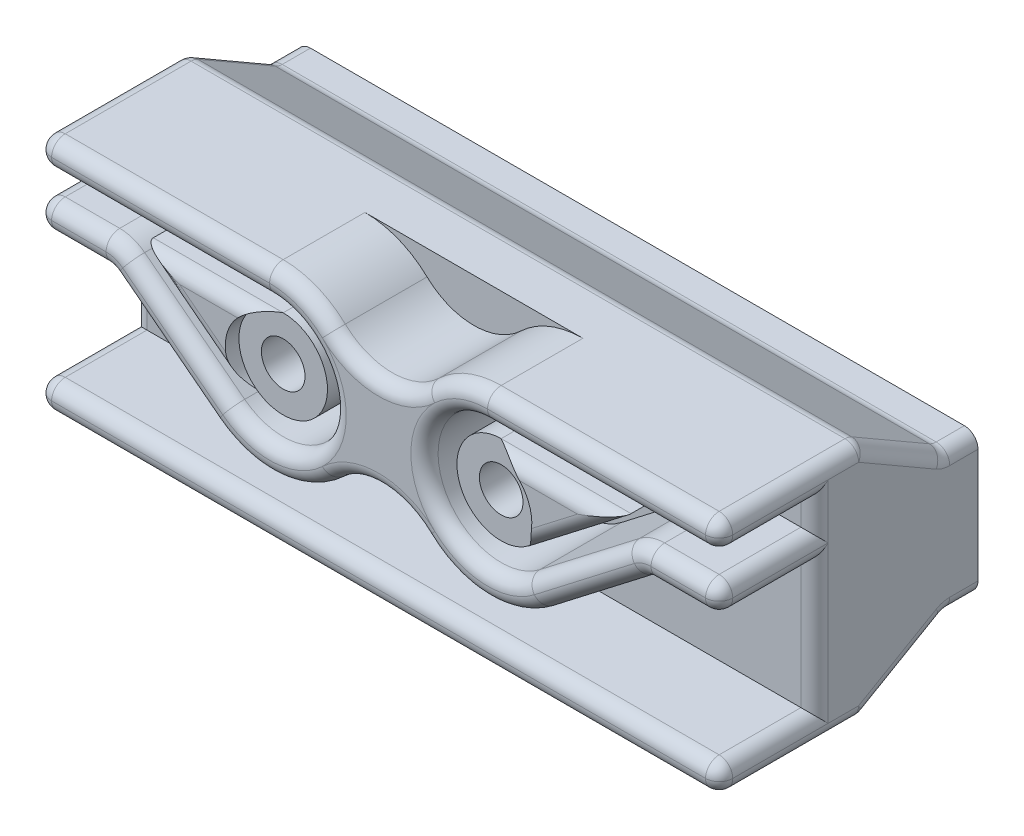
from build123d import *

# Parameters (mm, degrees)
SKETCH_1_W          = 50
SKETCH_1_H          = 17.48
EXTRUDE_1_DEPTH     = 12
EXTRUDE_START       = 12
SKETCH_1_3_W        = 50
SKETCH_1_3_H        = 2
EXTRUDE_2_DEPTH     = 7
SKETCH_1_4_R        = 1.6
CUT_EXTRUDE_1_DEPTH = 19
CUT_EXTRUDE_3_DEPTH = 25
FILLET_1_R          = 1
CUT_EXTRUDE_START   = -1
SKETCH_2_R          = 3.25
CUT_EXTRUDE_2_DEPTH = 1


with BuildPart() as part:
    # Эскиз1 → Бобышка-Вытянуть1 (new body)
    with BuildSketch(Plane.XY):
        Rectangle(SKETCH_1_W, SKETCH_1_H)
    extrude(amount=EXTRUDE_1_DEPTH)

    # Эскиз1<3> → Бобышка-Вытянуть2 (add)
    with BuildSketch(Plane.XY.offset(EXTRUDE_START)):
        with Locations((0, -7.74)):
            Rectangle(SKETCH_1_3_W, SKETCH_1_3_H)
        with BuildLine():
            Line((20, 2.73), (25, 2.73))
            Line((25, 2.73), (25, 4.73))
            Line((25, 4.73), (20, 4.73))
            ThreePointArc((20, 4.73), (19.032102254, 4.569572847), (18.167722561, 4.105449302))
            Line((18.167722561, 4.105449302), (10.827814847, -1.55611009))
            ThreePointArc((10.827814847, -1.55611009), (3.617592573, 0.616211145), (8, 6.74))
            Line((8, 6.74), (25, 6.74))
            Line((25, 6.74), (25, 8.74))
            Line((25, 8.74), (8, 8.74))
            ThreePointArc((8, 8.74), (5.545234329, 8.268816891), (3.439380911, 6.92223997))
            ThreePointArc((3.439380911, 6.92223997), (0, 5.551380219), (-3.439380911, 6.92223997))
            ThreePointArc((-3.439380911, 6.92223997), (-5.545234329, 8.268816891), (-8, 8.74))
            Line((-8, 8.74), (-25, 8.74))
            Line((-25, 8.74), (-25, 6.74))
            Line((-25, 6.74), (-8, 6.74))
            ThreePointArc((-8, 6.74), (-3.617592573, 0.616211145), (-10.827814847, -1.55611009))
            Line((-10.827814847, -1.55611009), (-18.167722561, 4.105449302))
            ThreePointArc((-18.167722561, 4.105449302), (-19.032102254, 4.569572847), (-20, 4.73))
            Line((-20, 4.73), (-25, 4.73))
            Line((-25, 4.73), (-25, 2.73))
            Line((-25, 2.73), (-20, 2.73))
            ThreePointArc((-20, 2.73), (-19.677367418, 2.676524282), (-19.389240854, 2.521816434))
            Line((-19.389240854, 2.521816434), (-12.04933314, -3.139742958))
            ThreePointArc((-12.04933314, -3.139742958), (-7.663539681, -4.511457125), (-3.439380911, -2.70223997))
            ThreePointArc((-3.439380911, -2.70223997), (0, -1.331380219), (3.439380911, -2.70223997))
            ThreePointArc((3.439380911, -2.70223997), (7.663539681, -4.511457125), (12.04933314, -3.139742958))
            Line((12.04933314, -3.139742958), (19.389240854, 2.521816434))
            ThreePointArc((19.389240854, 2.521816434), (19.677367418, 2.676524282), (20, 2.73))
        make_face()
        with BuildLine():
            Line((17.534697018, 5.36), (9.984967225, -0.463403411))
            ThreePointArc((9.984967225, -0.463403411), (4.923796082, 1.061444109), (8, 5.36))
            Line((8, 5.36), (17.534697018, 5.36))
        make_face()
        with BuildLine():
            Line((-8, 5.36), (-17.534697018, 5.36))
            Line((-17.534697018, 5.36), (-9.984967225, -0.463403411))
            ThreePointArc((-9.984967225, -0.463403411), (-4.923796082, 1.061444109), (-8, 5.36))
        make_face()
    extrude(amount=EXTRUDE_2_DEPTH)

    # Эскиз1<4> → Вырез-Вытянуть1 (cut)
    with BuildSketch(Plane.XY):
        with Locations((8, 2.11)):
            Circle(SKETCH_1_4_R)
        with Locations((-8, 2.11)):
            Circle(SKETCH_1_4_R)
    extrude(amount=CUT_EXTRUDE_1_DEPTH, mode=Mode.SUBTRACT)

    # Эскиз3 → Вырез-Вытянуть3 (cut, symmetric)
    with BuildSketch(Plane(origin=(0, 0, 0), x_dir=(0, 0, -1), z_dir=(1, 0, 0))):
        Polygon((0, 8.74), (0, 5.184936491), (-2.339557284, 5.184936491), (-8.497107907, 8.74), align=None)
        Polygon((0, -8.74), (0, -5.184936491), (-2.339557284, -5.184936491), (-8.497107907, -8.74), align=None)
    extrude(amount=CUT_EXTRUDE_3_DEPTH, both=True, mode=Mode.SUBTRACT)

    # Скругление1
    fillet_1_edges = [part.edges().sort_by_distance(p)[0] for p in [
        (-4.923796082, 1.061444109, 19),
        (-12.767348509, 5.36, 19),
        (-13.759832122, 2.448298295, 19),
        (0, 8.74, 8.497107907),
        (-25, -2.005, 12),
        (-25, 5.184936491, 1.169778642),
        (-25, 6.962468245, 5.418332596),
        (0, 5.184936491, 2.339557284),
        (25, 6.962468245, 5.418332596),
        (25, 5.184936491, 1.169778642),
        (25, -2.005, 12),
        (-25, -6.962468245, 5.418332596),
        (0, -8.74, 8.497107907),
        (-25, -5.184936491, 1.169778642),
        (0, -5.184936491, 2.339557284),
        (-25, -7.74, 19),
        (25, -5.184936491, 1.169778642),
        (25, -6.962468245, 5.418332596),
        (-25, -6.74, 15.5),
        (25, -6.74, 15.5),
        (0, -8.74, 19),
        (25, -7.74, 19),
        (0, -6.74, 19),
        (25, 5.735, 12),
        (-25, 5.735, 12),
        (15.719286997, -0.308963262, 19),
        (22.5, 2.73, 19),
        (25, 2.73, 15.5),
        (22.5, 4.73, 19),
        (25, 4.73, 15.5),
        (19.032102254, 4.569572847, 19),
        (14.497768704, 1.274669606, 19),
        (25, 6.74, 15.5),
        (16.5, 8.74, 19),
        (5.545234329, 8.268816891, 19),
        (-5.545234329, 8.268816891, 19),
        (-16.5, 8.74, 19),
        (-25, 7.74, 19),
        (-16.5, 6.74, 19),
        (-25, 6.74, 15.5),
        (-19.032102254, 4.569572847, 19),
        (-25, 3.73, 19),
        (-25, 4.73, 15.5),
        (-25, 2.73, 15.5),
        (-7.663539681, -4.511457125, 19),
        (7.663539681, -4.511457125, 19),
        (19.677367418, 2.676524282, 19),
        (25, 3.73, 19),
        (3.617592573, 0.616211145, 19),
        (16.5, 6.74, 19),
        (25, 7.74, 19),
        (0, 5.551380219, 19),
        (-3.617592573, 0.616211145, 19),
        (-14.497768704, 1.274669606, 19),
        (-22.5, 4.73, 19),
        (-22.5, 2.73, 19),
        (-19.677367418, 2.676524282, 19),
        (-15.719286997, -0.308963262, 19),
        (0, -1.331380219, 19),
        (-25, -8.74, 13.748553953),
        (25, -8.74, 13.748553953),
        (25, 8.74, 13.748553953),
        (-25, 8.74, 13.748553953),
        (4.923796082, 1.061444109, 19),
        (13.759832122, 2.448298295, 19),
        (12.767348509, 5.36, 19),
    ]]
    fillet(fillet_1_edges, radius=FILLET_1_R - 0.0001)  # a hair under: the kernel refuses the full size

    # Эскиз2 → Вырез-Вытянуть2 (cut)
    with BuildSketch(Plane.XY.offset(19).offset(CUT_EXTRUDE_START)):
        with Locations((-8, 2.11)):
            Circle(SKETCH_2_R)
        with Locations((8, 2.11)):
            Circle(SKETCH_2_R)
    extrude(amount=CUT_EXTRUDE_2_DEPTH, mode=Mode.SUBTRACT)


solid = part.part
